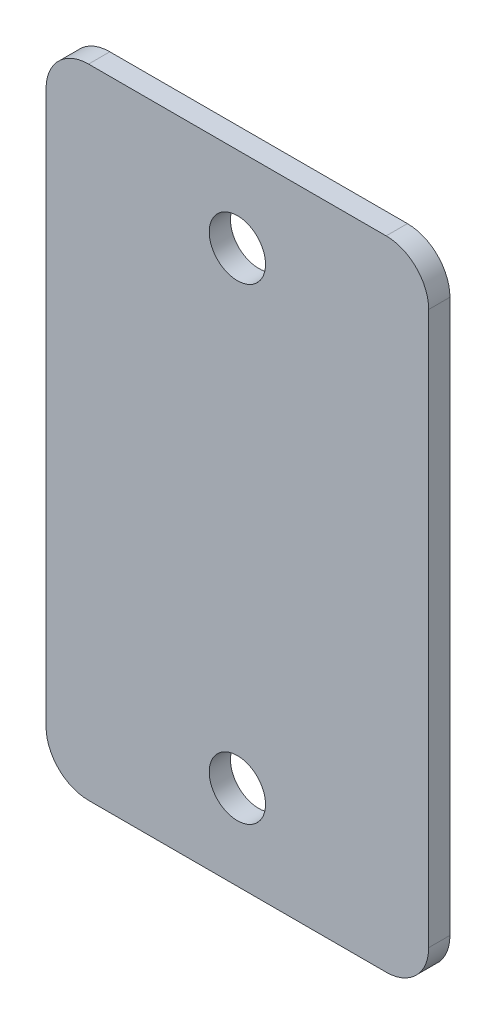
from build123d import *

# Parameters (mm, degrees)
SKETCH1_W            = 36
SKETCH1_H            = 60
BOSS_EXTRUDE1_DEPTH  = 1
M5_CLEARANCE_HOLE1_D = 5.3
FILLET1_R            = 4


with BuildPart() as part:
    # Sketch1 → Boss-Extrude1 (new, symmetric)
    with BuildSketch(Plane.XY):
        Rectangle(SKETCH1_W, SKETCH1_H)
    extrude(amount=BOSS_EXTRUDE1_DEPTH, both=True)

    # M5 Clearance Hole1 (through all)
    with Locations(Plane.XY.offset(1)):
        with Locations((0, 22), (0, -22)):
            Hole(M5_CLEARANCE_HOLE1_D / 2)

    # Fillet1
    fillet1_edges = [part.edges().sort_by_distance(p)[0] for p in [
        (18, -30, 0),
        (-18, -30, 0),
        (18, 30, 0),
        (-18, 30, 0),
    ]]
    fillet(fillet1_edges, radius=FILLET1_R)


solid = part.part
